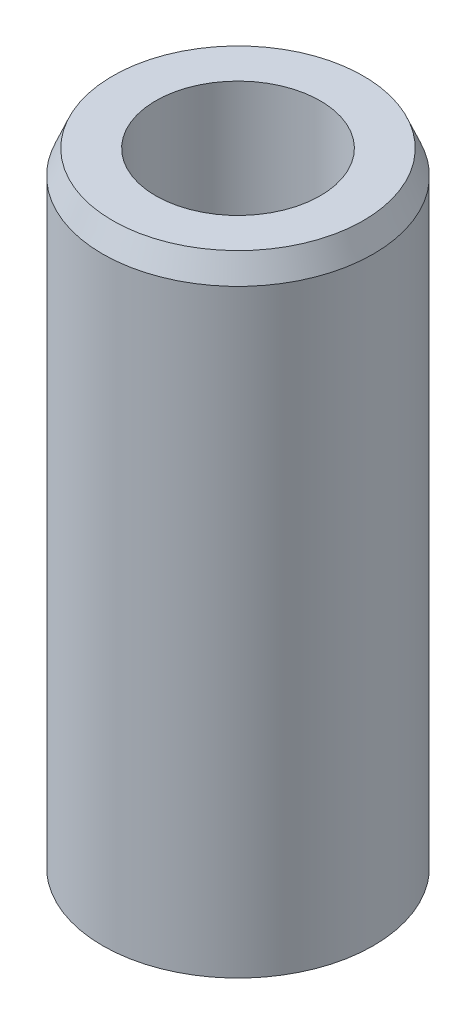
from build123d import *
from OCP.BRepFilletAPI import BRepFilletAPI_MakeChamfer

# Parameters (mm, degrees)
SKETCH1_R           = 17.5
BOSS_EXTRUDE1_DEPTH = 81.825064047
SKETCH2_R           = 10.641932538
CUT_EXTRUDE1_DEPTH  = 86.485911742
CHAMFER1_SIZE       = 3.08989599
CHAMFER1_SIZE2      = 1.296738695


with BuildPart() as part:
    # Sketch1 → Boss-Extrude1 (new body)
    with BuildSketch(Plane(origin=(0, 0, 0), x_dir=(1, 0, 0), z_dir=(0, 1, 0))):
        Circle(SKETCH1_R)
    extrude(amount=BOSS_EXTRUDE1_DEPTH)

    # Sketch2 → Cut-Extrude1 (cut, through all)
    with BuildSketch(Plane(origin=(0, 0, 0), x_dir=(1, 0, 0), z_dir=(0, 1, 0))):
        Circle(SKETCH2_R)
    extrude(amount=CUT_EXTRUDE1_DEPTH, mode=Mode.SUBTRACT)

    # Chamfer1: one chamfer whose edges measure the first distance from different faces: ONE call of the kernel's chamfer builder (chamfer() names one face for all edges)
    chamfer1_edges_1 = [part.edges().sort_by_distance(p)[0] for p in [
        (-17.5, 81.825064047, 0),
    ]]
    chamfer1_side_1 = [part.faces().sort_by_distance(p)[0] for p in [
        (-17.5, 40.912532024, 0),
    ]]
    chamfer1_edges_2 = [part.edges().sort_by_distance(p)[0] for p in [
        (-17.5, 0, 0),
    ]]
    chamfer1_side_2 = [part.faces().sort_by_distance(p)[0] for p in [
        (-17.005025253, 0, 0),
    ]]
    chamfer1 = BRepFilletAPI_MakeChamfer(part.part.solid().wrapped)
    for e in chamfer1_edges_1:
        chamfer1.Add(CHAMFER1_SIZE, CHAMFER1_SIZE2, e.wrapped, chamfer1_side_1[0].wrapped)  # the first distance lies on this face
    for e in chamfer1_edges_2:
        chamfer1.Add(CHAMFER1_SIZE, CHAMFER1_SIZE2, e.wrapped, chamfer1_side_2[0].wrapped)  # the first distance lies on this face
    add(Compound.cast(chamfer1.Shape()), mode=Mode.REPLACE)


solid = part.part
